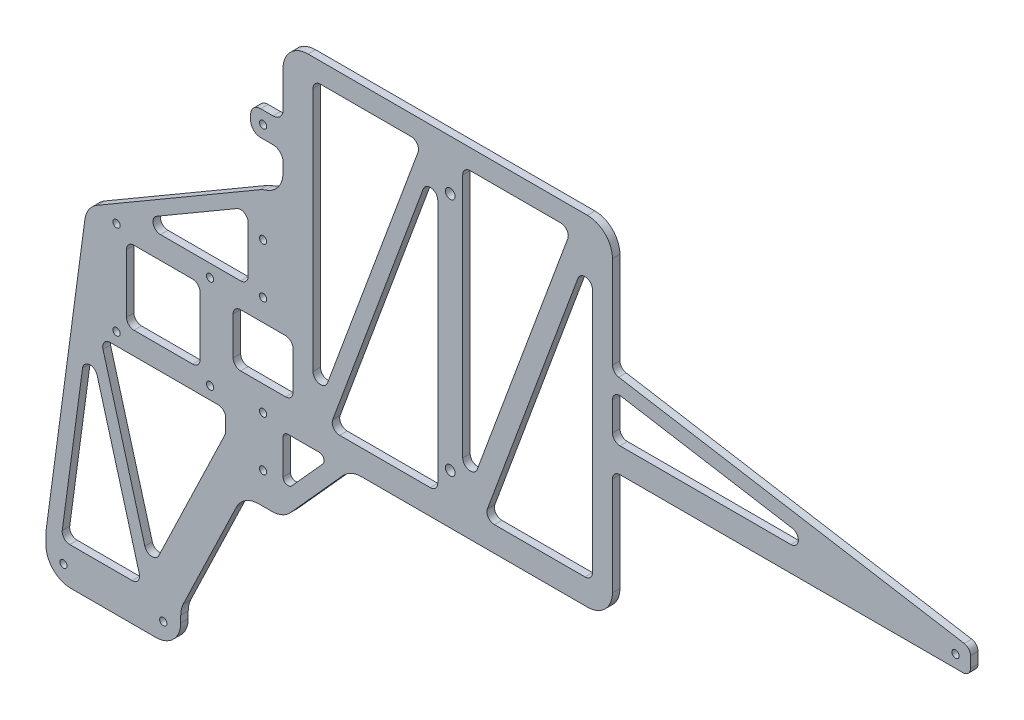
from build123d import *

# Parameters (mm, degrees)
SKETCH_1_R          = 1.45
SKETCH_1_R_2        = 1.95
SKETCH_1_W          = 50
SKETCH_1_H          = 118
SKETCH_1_W_2        = 52
SKETCH_1_W_3        = 29.5
SKETCH_1_H_2        = 29.5
SKETCH_1_W_4        = 24
SKETCH_1_H_3        = 21.25
EXTRUDE_1_DEPTH     = 3
EXTRUDE_2_DEPTH     = 3
FILLET_1_R          = 3
FILLET_2_R          = 10
FILLET_3_R          = 10
SKETCH_3_W          = 13
SKETCH_3_H          = 10
SKETCH_3_R          = 1.45
EXTRUDE_3_DEPTH     = 3
FILLET_4_R          = 4
SKETCH_4_W          = 143.5
SKETCH_4_H          = 10
SKETCH_4_R          = 1.45
EXTRUDE_4_DEPTH     = 3
EXTRUDE_5_DEPTH     = 3
FILLET_5_R          = 3
CUT_EXTRUDE_1_DEPTH = 363.570338004
FILLET_6_R          = 2


with BuildPart() as part:
    # 草图1 → 凸台-拉伸1 (new body)
    with BuildSketch(Plane.XY):
        Polygon((0, 60), (-8, 60), (-33, 8), (-33, -7), (-87, -7), (-87, 8), (-70.75, 128.75), (0, 170), (8, 170), (8, 226), (140, 226), (140, 90), (35, 90), (8, 60), align=None)
        with Locations((-80, 0)):
            Circle(SKETCH_1_R, mode=Mode.SUBTRACT)
        with Locations((-40, 0)):
            Circle(SKETCH_1_R, mode=Mode.SUBTRACT)
        with Locations((0, 72.5)):
            Circle(SKETCH_1_R, mode=Mode.SUBTRACT)
        with Locations((0, 92.5)):
            Circle(SKETCH_1_R, mode=Mode.SUBTRACT)
        with Locations((0, 132.5)):
            Circle(SKETCH_1_R, mode=Mode.SUBTRACT)
        with Locations((0, 152.5)):
            Circle(SKETCH_1_R, mode=Mode.SUBTRACT)
        with Locations((-58.75, 128.75)):
            Circle(SKETCH_1_R, mode=Mode.SUBTRACT)
        with Locations((-21.25, 128.75)):
            Circle(SKETCH_1_R, mode=Mode.SUBTRACT)
        with Locations((-21.25, 91.25)):
            Circle(SKETCH_1_R, mode=Mode.SUBTRACT)
        with Locations((-58.75, 91.25)):
            Circle(SKETCH_1_R, mode=Mode.SUBTRACT)
        with Locations((75, 206)):
            Circle(SKETCH_1_R_2, mode=Mode.SUBTRACT)
        with Locations((75, 110)):
            Circle(SKETCH_1_R_2, mode=Mode.SUBTRACT)
        with Locations((45, 159)):
            Rectangle(SKETCH_1_W, SKETCH_1_H, mode=Mode.SUBTRACT)
        with Locations((106, 159)):
            Rectangle(SKETCH_1_W_2, SKETCH_1_H, mode=Mode.SUBTRACT)
        Polygon((-15, 77.75059269), (-48.533938793, 8), (-80.945912041, 8), (-70.415373738, 86.25), (-15, 86.25), align=None, mode=Mode.SUBTRACT)
        Polygon((-52.247328604, 133.75), (-6, 160.713990175), (-6, 133.75), align=None, mode=Mode.SUBTRACT)
        with Locations((-40, 110)):
            Rectangle(SKETCH_1_W_3, SKETCH_1_H_2, mode=Mode.SUBTRACT)
        with Locations((0, 113.125)):
            Rectangle(SKETCH_1_W_4, SKETCH_1_H_3, mode=Mode.SUBTRACT)
    extrude(amount=EXTRUDE_1_DEPTH)

    # 草图2 → 凸台-拉伸2 (add)
    with BuildSketch(Plane.XY):
        Polygon((70, 218), (26.39653383, 100), (20, 100), (63.60346617, 218), align=None)
        Polygon((80, 100), (123.60346617, 218), (132, 218), (88.39653383, 100), align=None)
        Polygon((-48.533938793, 8), (-70.415373738, 86.25), (-65.223563587, 86.25), (-45.251391654, 14.82769805), align=None)
    extrude(amount=EXTRUDE_2_DEPTH)

    # 圆角1
    fillet_1_edges = [part.edges().sort_by_distance(p)[0] for p in [
        (-15, 77.75059269, 1.5),
        (-15, 86.25, 1.5),
        (-70.415373738, 86.25, 1.5),
        (-80.945912041, 8, 1.5),
        (-48.533938793, 8, 1.5),
        (-25.25, 95.25, 1.5),
        (-25.25, 124.75, 1.5),
        (-54.75, 124.75, 1.5),
        (-54.75, 95.25, 1.5),
        (-52.247328604, 133.75, 1.5),
        (-6, 133.75, 1.5),
        (-6, 160.713990175, 1.5),
        (12, 102.5, 1.5),
        (12, 123.75, 1.5),
        (-12, 123.75, 1.5),
        (-12, 102.5, 1.5),
        (-45.251391654, 14.82769805, 1.5),
        (-65.223563587, 86.25, 1.5),
        (88.39653383, 100, 1.5),
        (123.60346617, 218, 1.5),
        (63.60346617, 218, 1.5),
        (26.39653383, 100, 1.5),
        (70, 100, 1.5),
        (70, 218, 1.5),
        (20, 218, 1.5),
        (20, 100, 1.5),
        (132, 100, 1.5),
        (132, 218, 1.5),
        (80, 218, 1.5),
        (80, 100, 1.5),
    ]]
    fillet(fillet_1_edges, radius=FILLET_1_R)

    # 圆角2
    # the kernel refuses this fillet: 10 mm, written as the material it adds along each edge
    with BuildSketch(Plane(origin=(8, 170, 0), x_dir=(-1, 0, 0), z_dir=(0, 0, 1))) as fillet_2_piece_1:
        with BuildLine():
            CenterArc((10, -9.797958971), FILLET_2_R, 101.536959033, 78.463040967)
            Line((0, -9.797958971), (-0.2, -9.797958971))
            Line((-0.2, -9.797958971), (-0.2, 0))
            Line((-0.2, 0), (0, 0.2))
            ThreePointArc((0, 0.2), (4, 0.2), (7.96, 0.195959179))
            Line((7.96, 0.195959179), (8, 0))
        make_face()
    extrude(amount=3)

    # 圆角3
    fillet_3_edges = [part.edges().sort_by_distance(p)[0] for p in [
        (-8, 60, 1.5),
        (-33, 8, 1.5),
        (-33, -7, 1.5),
        (-87, -7, 1.5),
        (-87, 8, 1.5),
        (-70.75, 128.75, 1.5),
        (0, 170, 1.5),
        (8, 226, 1.5),
        (140, 226, 1.5),
        (140, 90, 1.5),
        (35, 90, 1.5),
        (8, 60, 1.5),
    ]]
    fillet(fillet_3_edges, radius=FILLET_3_R)

    # 草图3 → 凸台-拉伸3 (add)
    with BuildSketch(Plane.XY):
        with Locations((1.5, 192.5)):
            Rectangle(SKETCH_3_W, SKETCH_3_H)
        with Locations((0, 192.5)):
            Circle(SKETCH_3_R, mode=Mode.SUBTRACT)
    extrude(amount=EXTRUDE_3_DEPTH)

    # 圆角4
    fillet_4_edges = [part.edges().sort_by_distance(p)[0] for p in [
        (-5, 187.5, 1.5),
        (-5, 197.5, 1.5),
        (8, 197.5, 1.5),
        (8, 187.5, 1.5),
    ]]
    fillet(fillet_4_edges, radius=FILLET_4_R)

    # 草图4 → 凸台-拉伸4 (add)
    with BuildSketch(Plane.XY):
        with Locations((211.75, 147.5)):
            Rectangle(SKETCH_4_W, SKETCH_4_H)
        with Locations((277.5, 147.5)):
            Circle(SKETCH_4_R, mode=Mode.SUBTRACT)
    extrude(amount=EXTRUDE_4_DEPTH)

    # 草图5 → 凸台-拉伸5 (add)
    with BuildSketch(Plane.XY):
        Polygon((283.5, 152.5), (140, 176.5), (140, 170.5), (247.625, 152.5), align=None)
    extrude(amount=EXTRUDE_5_DEPTH)

    # 圆角5
    fillet_5_edges = [part.edges().sort_by_distance(p)[0] for p in [
        (283.5, 152.5, 1.5),
        (283.5, 142.5, 1.5),
        (140, 142.5, 1.5),
        (140, 152.5, 1.5),
        (247.625, 152.5, 1.5),
        (140, 176.5, 1.5),
        (140, 170.5, 1.5),
    ]]
    fillet(fillet_5_edges, radius=FILLET_5_R)

    # 草图6 → 切除-拉伸1 (cut, through all)
    with BuildSketch(Plane.XY.offset(3)):
        Polygon((8, 90), (8, 68.969082698), (26.927825572, 90), align=None)
    extrude(amount=-CUT_EXTRUDE_1_DEPTH, mode=Mode.SUBTRACT)

    # 圆角6
    fillet_6_edges = [part.edges().sort_by_distance(p)[0] for p in [
        (8, 90, 1.5),
        (26.927825572, 90, 1.5),
        (8, 68.969082698, 1.5),
    ]]
    fillet(fillet_6_edges, radius=FILLET_6_R)


solid = part.part
